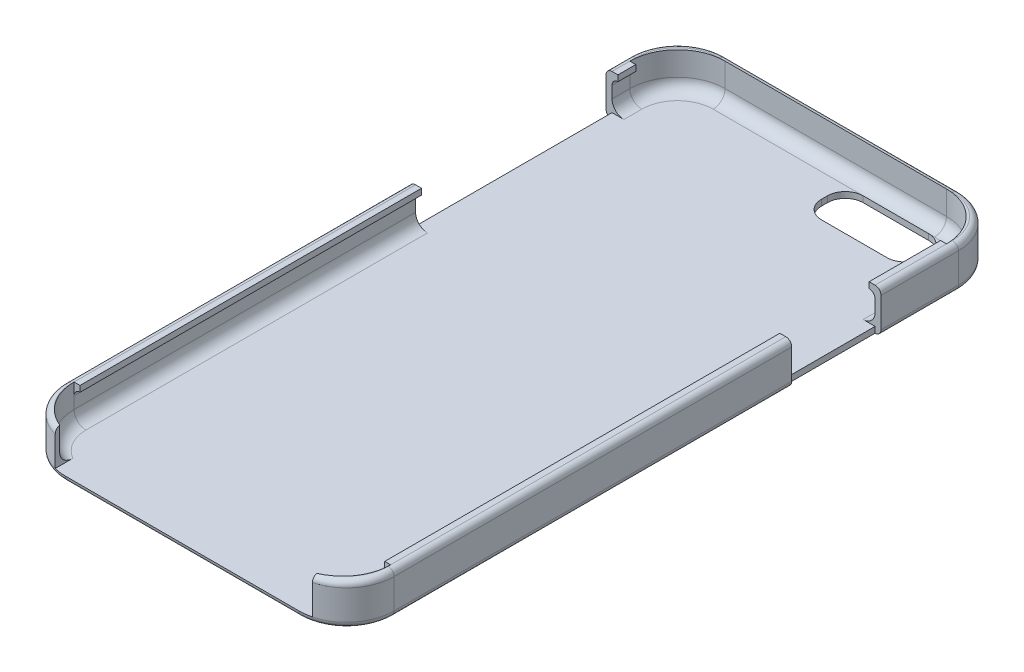
from build123d import *

# Parameters (mm, degrees)
SKETCH1_W           = 70.104
SKETCH1_H           = 140.716
BOSS_EXTRUDE1_DEPTH = 1.27
SKETCH2_W           = 67.564
SKETCH2_H           = 138.176
BOSS_EXTRUDE2_DEPTH = 7.62
SKETCH3_W           = 41.91
SKETCH3_H           = 7.62
CUT_EXTRUDE1_DEPTH  = 1.27
SKETCH5_W           = 19.05
SKETCH5_H           = 7.62
CUT_EXTRUDE2_DEPTH  = 1.27
SKETCH6_W           = 54.864
SKETCH6_H           = 7.62
CUT_EXTRUDE3_DEPTH  = 1.27
SKETCH7_W           = 21.59
SKETCH7_H           = 8.89
CUT_EXTRUDE4_DEPTH  = 1.27
FILLET1_R           = 10.16
FILLET2_R           = 10.16
SKETCH8_W           = 3.81
SKETCH8_H           = 1.27
BOSS_EXTRUDE3_DEPTH = 1.27
SKETCH14_W          = 15.24
SKETCH14_H          = 1.27
BOSS_EXTRUDE7_DEPTH = 1.27
SKETCH19_W          = 84.307427921
SKETCH19_H          = 1.27
BOSS_EXTRUDE8_DEPTH = 1.27
SKETCH20_W          = 72.877427921
SKETCH20_H          = 1.27
BOSS_EXTRUDE9_DEPTH = 1.27
FILLET9_R           = 3.81
FILLET12_R          = 1.27
FILLET15_R          = 1.27
FILLET16_R          = 2.54
SKETCH28_W          = 1.27
SKETCH28_H          = 19.05
SKETCH28_H_2        = 41.91
CUT_EXTRUDE10_DEPTH = 1.27
FILLET18_R          = 1.27


# Some blends are built 0.0001 mm under size
with BuildPart() as part:
    # Sketch1 → Boss-Extrude1 (new body)
    with BuildSketch(Plane(origin=(0, 0, 0), x_dir=(1, 0, 0), z_dir=(0, 1, 0))):
        Rectangle(SKETCH1_W, SKETCH1_H)
    extrude(amount=BOSS_EXTRUDE1_DEPTH)

    # Sketch2 → Boss-Extrude2 (add)
    with BuildSketch(Plane(origin=(0, 1.27, 0), x_dir=(1, 0, 0), z_dir=(0, 1, 0))):
        Polygon((-35.052, -70.358), (0, -70.358), (35.052, -70.358), (35.052, 70.358), (-35.052, 70.358), align=None)
        Rectangle(SKETCH2_W, SKETCH2_H, mode=Mode.SUBTRACT)
    extrude(amount=BOSS_EXTRUDE2_DEPTH)

    # Sketch3 → Cut-Extrude1 (cut)
    with BuildSketch(Plane.ZY.offset(35.052)):
        with Locations((-34.163, 5.08)):
            Rectangle(SKETCH3_W, SKETCH3_H)
    extrude(amount=-CUT_EXTRUDE1_DEPTH, mode=Mode.SUBTRACT)

    # Sketch5 → Cut-Extrude2 (cut)
    with BuildSketch(Plane(origin=(35.052, 0, 0), x_dir=(0, 0, -1), z_dir=(1, 0, 0))):
        with Locations((34.163, 5.08)):
            Rectangle(SKETCH5_W, SKETCH5_H)
    extrude(amount=-CUT_EXTRUDE2_DEPTH, mode=Mode.SUBTRACT)

    # Sketch6 → Cut-Extrude3 (cut)
    with BuildSketch(Plane.XY.offset(70.358)):
        with Locations((0, 5.08)):
            Rectangle(SKETCH6_W, SKETCH6_H)
    extrude(amount=-CUT_EXTRUDE3_DEPTH, mode=Mode.SUBTRACT)

    # Sketch7 → Cut-Extrude4 (cut)
    with BuildSketch(Plane.XZ):
        with Locations((15.367, -62.103)):
            Rectangle(SKETCH7_W, SKETCH7_H)
    extrude(amount=-CUT_EXTRUDE4_DEPTH, mode=Mode.SUBTRACT)

    # Fillet1
    # the kernel refuses this fillet: 10.16 mm, written as the material it adds along each edge
    with BuildSketch(Plane(origin=(33.782, 1.27, -69.088), x_dir=(0, 0, 1), z_dir=(0, 1, 0)), Plane(origin=(-33.782, 1.27, -69.088), x_dir=(1, 0, 0), z_dir=(0, 1, 0))) as fillet1_piece_1:
        with BuildLine():
            CenterArc((FILLET1_R, -FILLET1_R), FILLET1_R, 90, 90)
            Line((0, -FILLET1_R), (-FILLET1_R * 0.02, -FILLET1_R))
            Line((-FILLET1_R * 0.02, -FILLET1_R), (-FILLET1_R * 0.02, FILLET1_R * 0.02))
            Line((-FILLET1_R * 0.02, FILLET1_R * 0.02), (FILLET1_R, FILLET1_R * 0.02))
            Line((FILLET1_R, FILLET1_R * 0.02), (FILLET1_R, 0))
        make_face()
    extrude(amount=7.62)
    with BuildSketch(Plane(origin=(-33.782, 1.27, 69.088), x_dir=(0, 0, -1), z_dir=(0, 1, 0))) as fillet1_piece_2:
        with BuildLine():
            CenterArc((9.418572079, -10.16), FILLET1_R, 90, 67.975687163)
            Line((0, -6.35), (-0.188371442, -6.2738))
            ThreePointArc((-0.188371442, -6.2738), (-0.2032, -3.175), (-0.2032, 0))
            Line((-0.2032, 0), (0, 0.2032))
            Line((0, 0.2032), (9.418572079, 0.2032))
            Line((9.418572079, 0.2032), (9.418572079, 0))
        make_face()
    extrude(amount=7.62)
    with BuildSketch(Plane(origin=(33.782, 1.27, 69.088), x_dir=(-1, 0, 0), z_dir=(0, 1, 0))) as fillet1_piece_3:
        with BuildLine():
            CenterArc((10.16, -9.418572079), FILLET1_R, 112.024312837, 67.975687163)
            Line((0, -9.418572079), (-0.2032, -9.418572079))
            Line((-0.2032, -9.418572079), (-0.2032, 0))
            Line((-0.2032, 0), (0, 0.2032))
            ThreePointArc((0, 0.2032), (3.175, 0.2032), (6.2738, 0.188371442))
            Line((6.2738, 0.188371442), (6.35, 0))
        make_face()
    extrude(amount=7.62)

    # Fillet2
    fillet2_edges = [part.edges().sort_by_distance(p)[0] for p in [
        (-35.052, 4.445, -70.358),
        (35.052, 4.445, -70.358),
        (35.052, 4.445, 70.358),
        (-35.052, 4.445, 70.358),
    ]]
    fillet(fillet2_edges, radius=FILLET2_R)

    # Sketch8 → Boss-Extrude3 (add)
    with BuildSketch(Plane(origin=(-33.782, 0, 0), x_dir=(0, 0, -1), z_dir=(1, 0, 0))):
        with Locations((57.023, 8.255)):
            Rectangle(SKETCH8_W, SKETCH8_H)
    extrude(amount=BOSS_EXTRUDE3_DEPTH)

    # Sketch14 → Boss-Extrude7 (add)
    with BuildSketch(Plane.ZY.offset(-33.782)):
        with Locations((-51.308, 8.255)):
            Rectangle(SKETCH14_W, SKETCH14_H)
    extrude(amount=BOSS_EXTRUDE7_DEPTH)

    # Sketch19 → Boss-Extrude8 (add)
    with BuildSketch(Plane.ZY.offset(-33.782)):
        with Locations((17.515713961, 8.255)):
            Rectangle(SKETCH19_W, SKETCH19_H)
    extrude(amount=BOSS_EXTRUDE8_DEPTH)

    # Sketch20 → Boss-Extrude9 (add)
    with BuildSketch(Plane(origin=(-33.782, 0, 0), x_dir=(0, 0, -1), z_dir=(1, 0, 0))):
        with Locations((-23.230713961, 8.255)):
            Rectangle(SKETCH20_W, SKETCH20_H)
    extrude(amount=BOSS_EXTRUDE9_DEPTH)

    # Fillet9
    fillet9_edges = [part.edges().sort_by_distance(p)[0] for p in [
        (26.162, 0.635, -57.658),
        (26.162, 0.635, -66.548),
        (4.572, 0.635, -66.548),
        (4.572, 0.635, -57.658),
    ]]
    fillet(fillet9_edges, radius=FILLET9_R)

    # Fillet12
    fillet12_edges = [part.edges().sort_by_distance(p)[0] for p in [
        (32.076204897, 0, 67.382204897),
        (0, 0, 70.358),
        (-32.076204897, 0, 67.382204897),
        (-35.052, 0, 0),
        (-32.076204897, 0, -67.382204897),
        (0, 0, -70.358),
        (32.076204897, 0, -67.382204897),
        (35.052, 0, 0),
    ]]
    fillet(fillet12_edges, radius=FILLET12_R - 0.0001)  # a hair under: the kernel refuses the full size

    # Fillet15
    fillet15_edges = [part.edges().sort_by_distance(p)[0] for p in [
        (-35.052, 8.89, -57.658),
        (0, 8.89, -70.358),
        (-32.076204897, 8.89, -67.382204897),
        (35.052, 8.89, 17.78),
        (-35.052, 8.89, 23.495),
        (32.076204897, 8.89, -67.382204897),
        (32.924185257, 8.89, 66.419703947),
        (-32.924185257, 8.89, 66.419703947),
        (35.052, 8.89, -51.943),
    ]]
    fillet(fillet15_edges, radius=FILLET15_R - 0.0001)  # a hair under: the kernel refuses the full size

    # Fillet16
    fillet16_edges = [part.edges().sort_by_distance(p)[0] for p in [
        (0, 1.27, -69.088),
        (-33.782, 1.27, -57.023),
        (33.782, 1.27, 17.515713961),
        (-30.806204897, 1.27, -66.112204897),
        (30.806204897, 1.27, -66.112204897),
        (32.046226968, 1.27, 65.349040584),
        (-32.046226968, 1.27, 65.349040584),
        (-33.782, 1.27, 23.230713961),
        (33.782, 1.27, -51.308),
    ]]
    fillet(fillet16_edges, radius=FILLET16_R - 0.0001)  # a hair under: the kernel refuses the full size

    # Sketch28 → Cut-Extrude10 (cut)
    with BuildSketch(Plane(origin=(0, 1.27, 0), x_dir=(1, 0, 0), z_dir=(0, 1, 0))):
        with Locations((34.417, 34.163)):
            Rectangle(SKETCH28_W, SKETCH28_H)
        with Locations((-34.417, 34.163)):
            Rectangle(SKETCH28_W, SKETCH28_H_2)
    extrude(amount=-CUT_EXTRUDE10_DEPTH, mode=Mode.SUBTRACT)

    # Fillet18
    fillet18_edges = [part.edges().sort_by_distance(p)[0] for p in [
        (33.782, 7.62, -51.308),
        (-33.782, 7.62, -57.023),
        (33.782, 7.62, 17.515713961),
        (-33.782, 7.62, 23.230713961),
    ]]
    fillet(fillet18_edges, radius=FILLET18_R - 0.0001)  # a hair under: the kernel refuses the full size


solid = part.part
